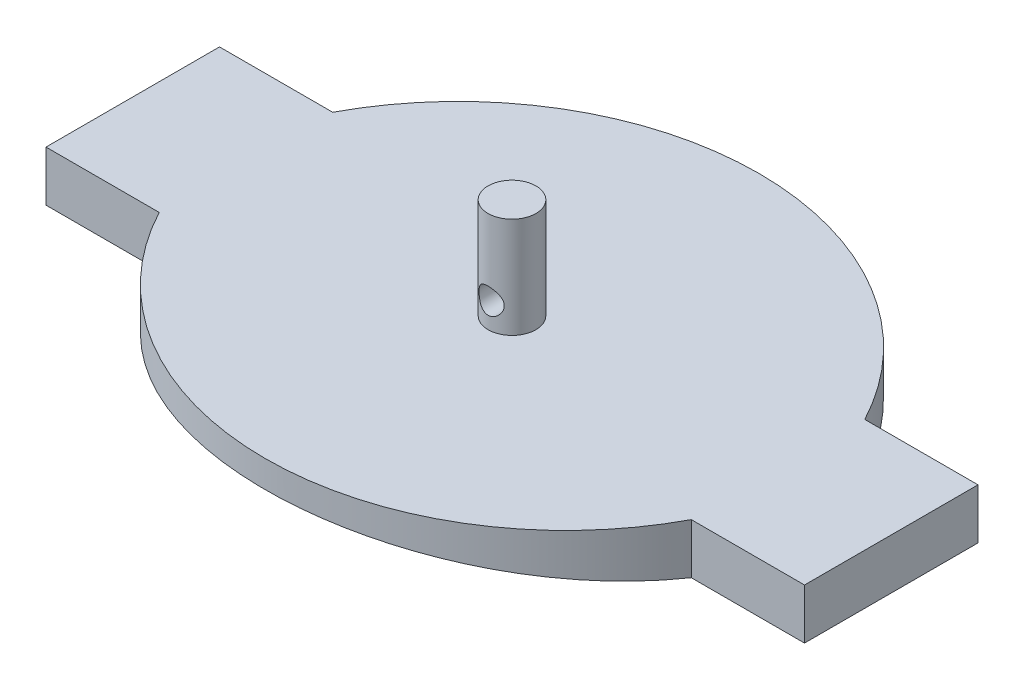
from build123d import *

# Parameters (mm, degrees)
BOSS_EXTRUDE3_DEPTH = 10
SKETCH5_R           = 4.75
BOSS_EXTRUDE4_DEPTH = 20
CUT_EXTRUDE1_REACH  = 99.306
SKETCH6_R           = 2.5
CUT_EXTRUDE2_REACH  = 129.264


with BuildPart() as part:
    # Sketch4 → Boss-Extrude3 (new body)
    with BuildSketch(Plane(origin=(0, 0, 0), x_dir=(1, 0, 0), z_dir=(0, 1, 0))):
        with BuildLine():
            Line((52.840693816, -62.117160098), (75.329495113, -62.117160098))
            Line((75.329495113, -62.117160098), (75.329495113, -27.656191848))
            Line((75.329495113, -27.656191848), (52.840693816, -27.656191848))
            ThreePointArc((52.840693816, -27.656191848), (0, 4.158390265), (-52.840693816, -27.656191848))
            Line((-52.840693816, -27.656191848), (-75.329495113, -27.656191848))
            Line((-75.329495113, -27.656191848), (-75.329495113, -62.117160098))
            Line((-75.329495113, -62.117160098), (-52.840693816, -62.117160098))
            ThreePointArc((-52.840693816, -62.117160098), (0, -93.931742211), (52.840693816, -62.117160098))
        make_face()
    extrude(amount=BOSS_EXTRUDE3_DEPTH)

    # Sketch5 → Boss-Extrude4 (add)
    with BuildSketch(Plane(origin=(0, 10, 0), x_dir=(1, 0, 0), z_dir=(0, 1, 0))):
        with Locations((0, -44.886675973)):
            Circle(SKETCH5_R)
    extrude(amount=BOSS_EXTRUDE4_DEPTH)

    # Sketch6 → Cut-Extrude1 (cut, up to next)
    with BuildSketch(Plane(origin=(0, 0, 40.136675973), x_dir=(-1, 0, 0), z_dir=(0, 0, -1)), mode=Mode.PRIVATE) as cut_extrude1_sk1:
        with Locations((0, 15)):
            Circle(SKETCH6_R)
    cut_extrude1_tool1 = extrude(cut_extrude1_sk1.sketch, amount=-CUT_EXTRUDE1_REACH, mode=Mode.PRIVATE) & part.part
    add(cut_extrude1_tool1.solids().sort_by_distance((0, 15, 40.136676))[0], mode=Mode.SUBTRACT)

    # Sketch7 → Cut-Extrude2 (cut, up to next)
    with BuildSketch(Plane.XY.offset(93.931742211), mode=Mode.PRIVATE) as cut_extrude2_sk1:
        with BuildLine():
            Line((-52.840693816, 0), (52.840693816, 0))
            ThreePointArc((52.840693816, 0), (0, 4.639468143), (-52.840693816, 0))
        make_face()
    cut_extrude2_tool1 = extrude(cut_extrude2_sk1.sketch, amount=-CUT_EXTRUDE2_REACH, mode=Mode.PRIVATE) & part.part
    add(cut_extrude2_tool1.solids().sort_by_distance((0, 1.85701, 93.931742))[0], mode=Mode.SUBTRACT)


solid = part.part
